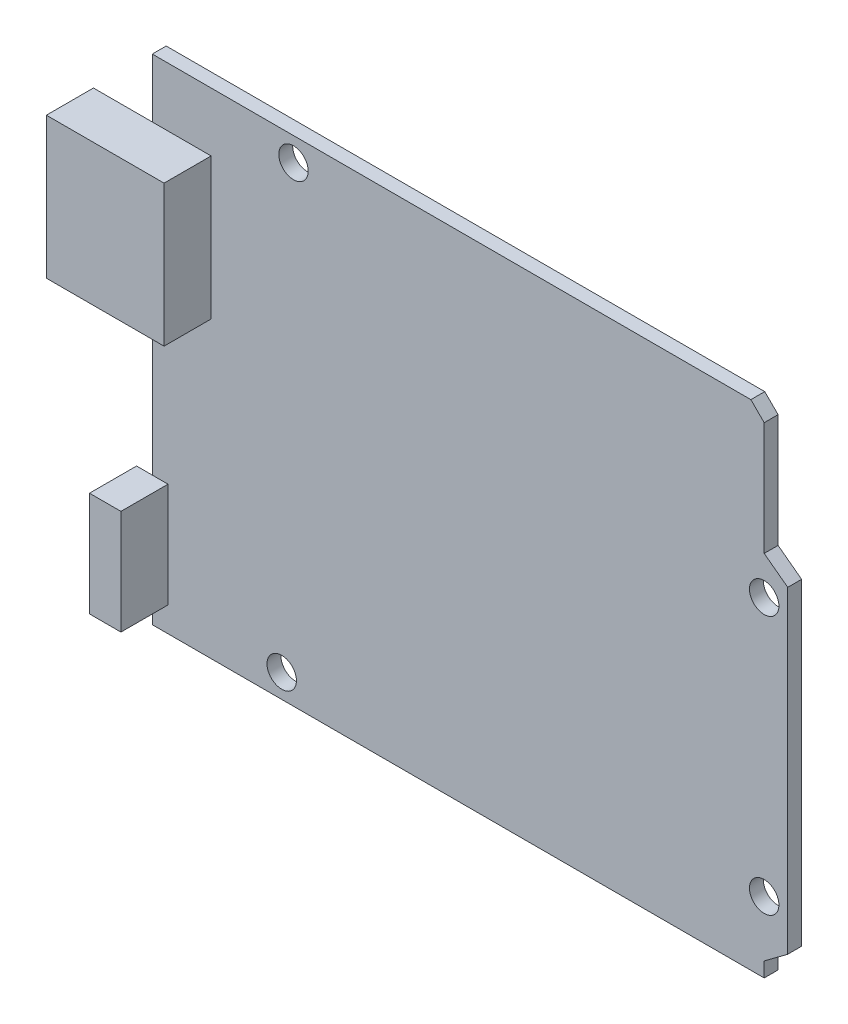
from build123d import *

# Parameters (mm, degrees)
SKETCH1_W           = 68.58
SKETCH1_H           = 53.34
BOSS_EXTRUDE1_DEPTH = 1.5
SKETCH2_W           = 12.7
SKETCH2_H           = 15.24
SKETCH2_W_2         = 3.39503639
SKETCH2_H_2         = 11.2855496
BOSS_EXTRUDE2_DEPTH = 5.08
SKETCH3_R           = 1.5875
CUT_EXTRUDE1_DEPTH  = 10.16
CUT_EXTRUDE2_DEPTH  = 49.874378768


with BuildPart() as part:
    # Sketch1 → Boss-Extrude1 (new body)
    with BuildSketch(Plane.XY):
        Rectangle(SKETCH1_W, SKETCH1_H)
    extrude(amount=BOSS_EXTRUDE1_DEPTH)

    # Sketch2 → Boss-Extrude2 (add)
    with BuildSketch(Plane.XY.offset(1.5)):
        with Locations((-34.29, 12.7)):
            Rectangle(SKETCH2_W, SKETCH2_H)
        with Locations((-34.29, -18.328779787)):
            Rectangle(SKETCH2_W_2, SKETCH2_H_2)
    extrude(amount=BOSS_EXTRUDE2_DEPTH)

    # Sketch3 → Cut-Extrude1 (cut)
    with BuildSketch(Plane.XY.offset(1.5)):
        with Locations((-19.05, 24.13)):
            Circle(SKETCH3_R)
        with Locations((-20.32, -24.13)):
            Circle(SKETCH3_R)
        with Locations((31.75, 8.89)):
            Circle(SKETCH3_R)
        with Locations((31.75, -19.05)):
            Circle(SKETCH3_R)
    extrude(amount=-CUT_EXTRUDE1_DEPTH, mode=Mode.SUBTRACT)

    # Sketch4 → Cut-Extrude2 (cut, through all)
    with BuildSketch(Plane.XY.offset(1.5)):
        Polygon((30.313159021, 26.67), (31.75, 25.233159021), (31.75, 13.012702255), (34.29, 11.115796447), (34.29, 26.67), align=None)
        Polygon((34.29, -23.181547096), (31.75, -25.078452904), (31.75, -26.67), (34.29, -26.67), align=None)
    extrude(amount=-CUT_EXTRUDE2_DEPTH, mode=Mode.SUBTRACT)


solid = part.part
